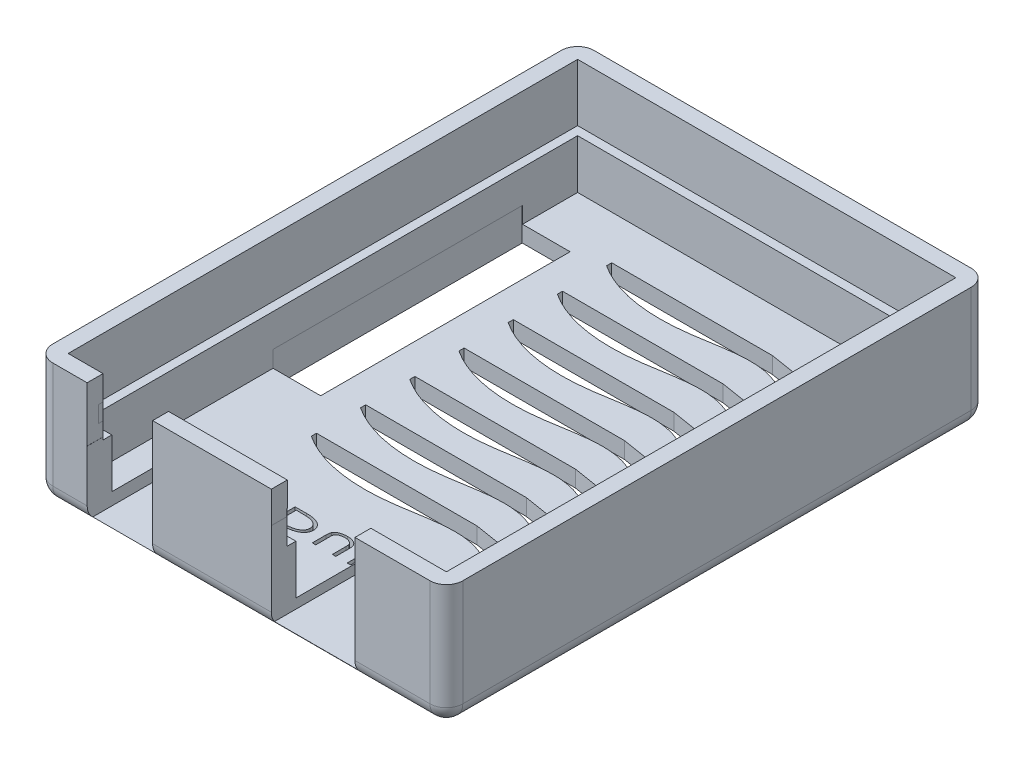
from build123d import *

# Parameters (mm, degrees)
SKETCH1_W           = 63.5
SKETCH1_H           = 83.82
BOSS_EXTRUDE1_DEPTH = 12.7
SKETCH3_W           = 55.88
SKETCH3_H           = 76.2
CUT_EXTRUDE1_DEPTH  = 15.24
SKETCH4_W           = 63.5
SKETCH4_H           = 83.82
SKETCH4_W_2         = 58.5724
SKETCH4_H_2         = 78.8924
BOSS_EXTRUDE2_DEPTH = 3.81
SKETCH5_W           = 63.5
SKETCH5_H           = 83.82
BOSS_EXTRUDE3_DEPTH = 2.54
SKETCH8_W           = 12.955380848
SKETCH8_H           = 11.85067447
CUT_EXTRUDE2_DEPTH  = 10.16
SKETCH9_W           = 10.132782245
SKETCH9_H           = 12.7
CUT_EXTRUDE3_DEPTH  = 15.24
SKETCH12_W          = 12.942292939
SKETCH12_H          = 9.189629165
SKETCH12_W_2        = 10.145904329
SKETCH12_H_2        = 9.559094667
CUT_EXTRUDE6_DEPTH  = 2.54
SKETCH13_W          = 12.972569565
SKETCH13_H          = 1.805943313
CUT_EXTRUDE7_DEPTH  = 2.54
SKETCH15_W          = 10.147954147
SKETCH15_H          = 2.455098586
CUT_EXTRUDE8_DEPTH  = 2.54
SKETCH16_W          = 58.5724
SKETCH16_H          = 78.8924
CUT_EXTRUDE9_DEPTH  = 5.08
SKETCH17_W          = 10.133611687
SKETCH17_H          = 1.27
SKETCH17_W_2        = 12.955380848
CUT_EXTRUDE10_DEPTH = 12.7
CUT_EXTRUDE11_START = -1.501766
SKETCH18_W          = 12.993067215
SKETCH18_H          = 5.08
CUT_EXTRUDE11_DEPTH = 1.501766
SKETCH19_W          = 10.132782245
SKETCH19_H          = 2.54
CUT_EXTRUDE12_DEPTH = 1.27
SKETCH21_W          = 7.415059291
SKETCH21_H          = 38.632759047
SKETCH21_W_2        = 7.602045691
SKETCH21_H_2        = 47.968625751
CUT_EXTRUDE13_DEPTH = 5.08
CUT_EXTRUDE14_DEPTH = 5.08
FILLET1_R           = 2.54
SKETCH23_W          = 0.538461539
SKETCH23_H          = 3.5
CUT_EXTRUDE17_DEPTH = 5.08
FILLET2_R           = 2.54


with BuildPart() as part:
    # Sketch1 → Boss-Extrude1 (new body)
    with BuildSketch(Plane(origin=(0, 0, 0), x_dir=(1, 0, 0), z_dir=(0, 1, 0))):
        Rectangle(SKETCH1_W, SKETCH1_H)
    extrude(amount=BOSS_EXTRUDE1_DEPTH)

    # Sketch3 → Cut-Extrude1 (cut)
    with BuildSketch(Plane(origin=(0, 12.7, 0), x_dir=(1, 0, 0), z_dir=(0, 1, 0))):
        Rectangle(SKETCH3_W, SKETCH3_H)
    extrude(amount=-CUT_EXTRUDE1_DEPTH, mode=Mode.SUBTRACT)

    # Sketch4 → Boss-Extrude2 (add)
    with BuildSketch(Plane(origin=(0, 12.7, 0), x_dir=(1, 0, 0), z_dir=(0, 1, 0))):
        Rectangle(SKETCH4_W, SKETCH4_H)
        Rectangle(SKETCH4_W_2, SKETCH4_H_2, mode=Mode.SUBTRACT)
    extrude(amount=BOSS_EXTRUDE2_DEPTH)

    # Sketch5 → Boss-Extrude3 (add)
    with BuildSketch(Plane(origin=(0, 0, 0), x_dir=(-1, 0, 0), z_dir=(0, -1, 0))):
        Rectangle(SKETCH5_W, SKETCH5_H)
    extrude(amount=BOSS_EXTRUDE3_DEPTH)

    # Sketch8 → Cut-Extrude2 (cut)
    with BuildSketch(Plane.XY.offset(41.91)):
        with Locations((11.109652355, 5.693570988)):
            Rectangle(SKETCH8_W, SKETCH8_H)
    extrude(amount=-CUT_EXTRUDE2_DEPTH, mode=Mode.SUBTRACT)

    # Sketch9 → Cut-Extrude3 (cut)
    with BuildSketch(Plane.XY.offset(41.91)):
        with Locations((-18.810194058, 5.71019893)):
            Rectangle(SKETCH9_W, SKETCH9_H)
    extrude(amount=-CUT_EXTRUDE3_DEPTH, mode=Mode.SUBTRACT)

    # Sketch12 → Cut-Extrude6 (cut)
    with BuildSketch(Plane.XY.offset(41.91)):
        with Locations((11.11619631, 13.960920215)):
            Rectangle(SKETCH12_W, SKETCH12_H)
        with Locations((-18.816755099, 12.801375619)):
            Rectangle(SKETCH12_W_2, SKETCH12_H_2)
    extrude(amount=-CUT_EXTRUDE6_DEPTH, mode=Mode.SUBTRACT)

    # Sketch13 → Cut-Extrude7 (cut)
    with BuildSketch(Plane(origin=(0, 12.7, 0), x_dir=(1, 0, 0), z_dir=(0, 1, 0))):
        with Locations((11.122724292, -38.668967122)):
            Rectangle(SKETCH13_W, SKETCH13_H)
    extrude(amount=-CUT_EXTRUDE7_DEPTH, mode=Mode.SUBTRACT)

    # Sketch15 → Cut-Extrude8 (cut)
    with BuildSketch(Plane(origin=(0, 12.7, 0), x_dir=(1, 0, 0), z_dir=(0, 1, 0))):
        with Locations((-18.817780009, -38.931642821)):
            Rectangle(SKETCH15_W, SKETCH15_H)
    extrude(amount=-CUT_EXTRUDE8_DEPTH, mode=Mode.SUBTRACT)

    # Sketch16 → Cut-Extrude9 (cut)
    with BuildSketch(Plane(origin=(0, 12.7, 0), x_dir=(1, 0, 0), z_dir=(0, 1, 0))):
        Rectangle(SKETCH16_W, SKETCH16_H)
    extrude(amount=-CUT_EXTRUDE9_DEPTH, mode=Mode.SUBTRACT)

    # Sketch17 → Cut-Extrude10 (cut)
    with BuildSketch(Plane.XY.offset(41.91)):
        with Locations((-18.809779337, -1.27480107)):
            Rectangle(SKETCH17_W, SKETCH17_H)
        with Locations((11.109652355, -0.866766247)):
            Rectangle(SKETCH17_W_2, SKETCH17_H)
    extrude(amount=-CUT_EXTRUDE10_DEPTH, mode=Mode.SUBTRACT)

    # Sketch18 → Cut-Extrude11 (cut)
    with BuildSketch(Plane(origin=(0, 0, 0), x_dir=(1, 0, 0), z_dir=(0, 1, 0)).offset(CUT_EXTRUDE11_START)):
        with Locations((11.128495539, -29.21)):
            Rectangle(SKETCH18_W, SKETCH18_H)
    extrude(amount=CUT_EXTRUDE11_DEPTH, mode=Mode.SUBTRACT)

    # Sketch19 → Cut-Extrude12 (cut)
    with BuildSketch(Plane(origin=(0, -0.63980107, 0), x_dir=(1, 0, 0), z_dir=(0, 1, 0))):
        with Locations((-18.810194058, -27.94)):
            Rectangle(SKETCH19_W, SKETCH19_H)
    extrude(amount=-CUT_EXTRUDE12_DEPTH, mode=Mode.SUBTRACT)

    # Sketch21 → Cut-Extrude13 (cut)
    with BuildSketch(Plane(origin=(0, -2.54, 0), x_dir=(-1, 0, 0), z_dir=(0, -1, 0))):
        with Locations((24.279917783, 10.255762407)):
            Rectangle(SKETCH21_W, SKETCH21_H)
        with Locations((-24.085027372, 5.66722687)):
            Rectangle(SKETCH21_W_2, SKETCH21_H_2)
    extrude(amount=-CUT_EXTRUDE13_DEPTH, mode=Mode.SUBTRACT)

    # Sketch22 → Cut-Extrude14 (cut)
    with BuildSketch(Plane.XZ.offset(2.54)):
        with BuildLine():
            Line((13.960151208, 18.364141509), (13.960151208, 15.206601395))
            Line((13.960151208, 15.206601395), (8.996481101, 14.406807536))
            Line((8.996481101, 14.406807536), (-15.870995504, 14.406807536))
            Line((-15.870995504, 14.406807536), (-15.870995504, 15.206601395))
            add(Edge.make_bspline(
                [(13.960151208, 18.364141509), (9.206801531, 15.593589968), (-0.809040501, 19.194103188), (-11.638896479, 17.993086123), (-15.870995504, 15.206601395)],
                knots=[0, 0, 0, 0, 0.502363347, 1, 1, 1, 1], degree=3))
        make_face()
        with BuildLine():
            Line((13.960151208, 10.744141509), (13.960151208, 7.586601395))
            Line((13.960151208, 7.586601395), (8.996481101, 6.786807536))
            Line((8.996481101, 6.786807536), (-15.870995504, 6.786807536))
            Line((-15.870995504, 6.786807536), (-15.870995504, 7.586601395))
            add(Edge.make_bspline(
                [(13.960151208, 10.744141509), (9.206801531, 7.973589968), (-0.809040501, 11.574103188), (-11.638896479, 10.373086123), (-15.870995504, 7.586601395)],
                knots=[0, 0, 0, 0, 0.502363347, 1, 1, 1, 1], degree=3))
        make_face()
        with BuildLine():
            Line((13.960151208, 3.124141509), (13.960151208, -0.033398605))
            Line((13.960151208, -0.033398605), (8.996481101, -0.833192464))
            Line((8.996481101, -0.833192464), (-15.870995504, -0.833192464))
            Line((-15.870995504, -0.833192464), (-15.870995504, -0.033398605))
            add(Edge.make_bspline(
                [(13.960151208, 3.124141509), (9.206801531, 0.353589968), (-0.809040501, 3.954103188), (-11.638896479, 2.753086123), (-15.870995504, -0.033398605)],
                knots=[0, 0, 0, 0, 0.502363347, 1, 1, 1, 1], degree=3))
        make_face()
        with BuildLine():
            Line((13.960151208, -4.495858491), (13.960151208, -7.653398605))
            Line((13.960151208, -7.653398605), (8.996481101, -8.453192464))
            Line((8.996481101, -8.453192464), (-15.870995504, -8.453192464))
            Line((-15.870995504, -8.453192464), (-15.870995504, -7.653398605))
            add(Edge.make_bspline(
                [(13.960151208, -4.495858491), (9.206801531, -7.266410032), (-0.809040501, -3.665896812), (-11.638896479, -4.866913877), (-15.870995504, -7.653398605)],
                knots=[0, 0, 0, 0, 0.502363347, 1, 1, 1, 1], degree=3))
        make_face()
        with BuildLine():
            Line((13.960151208, -12.115858491), (13.960151208, -15.273398605))
            Line((13.960151208, -15.273398605), (8.996481101, -16.073192464))
            Line((8.996481101, -16.073192464), (-15.870995504, -16.073192464))
            Line((-15.870995504, -16.073192464), (-15.870995504, -15.273398605))
            add(Edge.make_bspline(
                [(13.960151208, -12.115858491), (9.206801531, -14.886410032), (-0.809040501, -11.285896812), (-11.638896479, -12.486913877), (-15.870995504, -15.273398605)],
                knots=[0, 0, 0, 0, 0.502363347, 1, 1, 1, 1], degree=3))
        make_face()
        with BuildLine():
            Line((13.960151208, -19.735858491), (13.960151208, -22.893398605))
            Line((13.960151208, -22.893398605), (8.996481101, -23.693192464))
            Line((8.996481101, -23.693192464), (-15.870995504, -23.693192464))
            Line((-15.870995504, -23.693192464), (-15.870995504, -22.893398605))
            add(Edge.make_bspline(
                [(13.960151208, -19.735858491), (9.206801531, -22.506410032), (-0.809040501, -18.905896812), (-11.638896479, -20.106913877), (-15.870995504, -22.893398605)],
                knots=[0, 0, 0, 0, 0.502363347, 1, 1, 1, 1], degree=3))
        make_face()
        with BuildLine():
            Line((13.960151208, -27.355858491), (13.960151208, -30.513398605))
            Line((13.960151208, -30.513398605), (8.996481101, -31.313192464))
            Line((8.996481101, -31.313192464), (-15.870995504, -31.313192464))
            Line((-15.870995504, -31.313192464), (-15.870995504, -30.513398605))
            add(Edge.make_bspline(
                [(13.960151208, -27.355858491), (9.206801531, -30.126410032), (-0.809040501, -26.525896812), (-11.638896479, -27.726913877), (-15.870995504, -30.513398605)],
                knots=[0, 0, 0, 0, 0.502363347, 1, 1, 1, 1], degree=3))
        make_face()
    extrude(amount=-CUT_EXTRUDE14_DEPTH, mode=Mode.SUBTRACT)

    # Fillet1
    # the kernel refuses this fillet: 2.54 mm, written as the material it takes off along each edge
    with BuildSketch(Plane(origin=(-38.1, -2.54, -41.91), x_dir=(0, 1, 0), z_dir=(1, 0, 0))) as fillet1_piece_1:
        with BuildLine():
            CenterArc((FILLET1_R, FILLET1_R), FILLET1_R, 180, 90)
            Line((0, FILLET1_R), (0, 0))
            Line((0, 0), (FILLET1_R, 0))
        make_face()
    extrude(amount=76.2, mode=Mode.SUBTRACT)
    with BuildSketch(Plane(origin=(-31.75, -2.54, 48.26), x_dir=(1, 0, 0), z_dir=(0, 0, -1))) as fillet1_piece_2:
        with BuildLine():
            CenterArc((FILLET1_R, -FILLET1_R), FILLET1_R, 90, 90)
            Line((0, -FILLET1_R), (0, 0))
            Line((0, 0), (FILLET1_R, 0))
        make_face()
    extrude(amount=96.52, mode=Mode.SUBTRACT)
    with BuildSketch(Plane(origin=(38.1, -2.54, 41.91), x_dir=(0, 0, -1), z_dir=(-1, 0, 0))) as fillet1_piece_3:
        with BuildLine():
            CenterArc((FILLET1_R, -FILLET1_R), FILLET1_R, 90, 90)
            Line((0, -FILLET1_R), (0, 0))
            Line((0, 0), (FILLET1_R, 0))
        make_face()
    extrude(amount=76.2, mode=Mode.SUBTRACT)
    with BuildSketch(Plane(origin=(31.75, -2.54, -48.26), x_dir=(0, 1, 0), z_dir=(0, 0, 1))) as fillet1_piece_4:
        with BuildLine():
            CenterArc((FILLET1_R, FILLET1_R), FILLET1_R, 180, 90)
            Line((0, FILLET1_R), (0, 0))
            Line((0, 0), (FILLET1_R, 0))
        make_face()
    extrude(amount=96.52, mode=Mode.SUBTRACT)

    # Sketch23 → Cut-Extrude17 (cut)
    # profile 1 of 7: a face of its own
    with BuildSketch(Plane.XZ.offset(2.54)):
        Polygon((-16.712112289, 29.431104987), (-14.154419981, 25.931104987), (-14.74756902, 25.931104987), (-15.567180398, 27.052899859), (-17.974832642, 27.052899859), (-18.809167577, 25.931104987), (-19.404419981, 25.931104987), (-16.801855879, 29.431104987), align=None)
        Polygon((-16.761190815, 28.685812519), (-17.708406359, 27.411874218), (-15.829399949, 27.411874218), align=None, mode=Mode.SUBTRACT)
    # profile 2 of 7: a face of its own
    with BuildSketch(Plane.XZ.offset(2.54)):
        with BuildLine():
            Line((-12.790317417, 29.431104987), (-11.675533763, 29.431104987))
            add(Edge.make_bspline(
                [(-11.675533763, 29.431104987), (-11.600981338, 29.430951106), (-11.4581833, 29.430656362), (-11.253434401, 29.42897401), (-11.067420098, 29.424211029), (-10.900264487, 29.420126725), (-10.751887259, 29.412583378), (-10.62209828, 29.405483023), (-10.510999879, 29.396078054), (-10.443406349, 29.387369989), (-10.412813411, 29.383428705)],
                knots=[0, 0, 0, 0, 1.415159153, 2.710601944, 3.886499888, 4.947209645, 5.884301401, 6.706450434, 7.414537418, 8, 8, 8, 8], degree=3))
            add(Edge.make_bspline(
                [(-10.412813411, 29.383428705), (-10.372058355, 29.377141148), (-10.292235397, 29.364826323), (-10.176266387, 29.338400266), (-10.066009817, 29.307660242), (-9.961328002, 29.272269421), (-9.862891286, 29.230599259), (-9.770128333, 29.184292701), (-9.682774842, 29.133381175), (-9.602722685, 29.076608294), (-9.529292871, 29.016716978), (-9.465416473, 28.952458518), (-9.411591935, 28.884335889), (-9.366661213, 28.813519673), (-9.333198893, 28.738404319), (-9.308093595, 28.66048149), (-9.293107084, 28.57888177), (-9.291253323, 28.52321288), (-9.290317417, 28.495107391)],
                knots=[0, 0, 0, 0, 1.268032383, 2.483571505, 3.65563143, 4.787705483, 5.8797964, 6.940662136, 7.975015907, 8.986154035, 9.956240188, 10.886435316, 11.766594594, 12.622284502, 13.458736103, 14.288520174, 15.135927109, 16, 16, 16, 16], degree=3))
            add(Edge.make_bspline(
                [(-9.290317417, 28.495107391), (-9.291055535, 28.471474734), (-9.292516233, 28.424706909), (-9.302233144, 28.355475994), (-9.320000967, 28.288854791), (-9.344312341, 28.224469116), (-9.373960136, 28.161604815), (-9.412867087, 28.102064915), (-9.456646731, 28.043527227), (-9.508239324, 27.988264265), (-9.565884736, 27.935781336), (-9.629009532, 27.88591121), (-9.698099186, 27.839424109), (-9.77323286, 27.79683148), (-9.85437561, 27.757549358), (-9.94116135, 27.721139536), (-10.033899158, 27.688318022), (-10.132806098, 27.658552139), (-10.239602825, 27.632809677), (-10.355257434, 27.60934166), (-10.480819309, 27.591194226), (-10.615661638, 27.574782357), (-10.760188959, 27.562409651), (-10.91449117, 27.553424066), (-11.078370155, 27.547771859), (-11.190820272, 27.546924582), (-11.24855059, 27.546489602)],
                knots=[0, 0, 0, 0, 0.707777751, 1.400656194, 2.088211549, 2.768136518, 3.45995362, 4.164783657, 4.894105013, 5.646958891, 6.424744507, 7.227084093, 8.054048316, 8.916106943, 9.811366436, 10.752482584, 11.733185226, 12.756207988, 13.84434188, 15.022068865, 16.289085255, 17.642525751, 19.089840076, 20.632334465, 22.271087571, 24, 24, 24, 24], degree=3))
            Line((-11.24855059, 27.546489602), (-9.245445622, 25.931104987))
            Line((-9.245445622, 25.931104987), (-9.929039372, 25.931104987))
            Line((-9.929039372, 25.931104987), (-11.93214434, 27.546489602))
            Line((-11.93214434, 27.546489602), (-12.251855879, 27.546489602))
            Line((-12.251855879, 27.546489602), (-12.251855879, 25.931104987))
            Line((-12.251855879, 25.931104987), (-12.790317417, 25.931104987))
            Line((-12.790317417, 25.931104987), (-12.790317417, 29.431104987))
        make_face()
        with BuildLine():
            Line((-12.251855879, 29.072130628), (-12.251855879, 27.905463961))
            Line((-12.251855879, 27.905463961), (-11.263274148, 27.900556109))
            add(Edge.make_bspline(
                [(-11.263274148, 27.900556109), (-11.216996458, 27.900539913), (-11.127464276, 27.900508579), (-10.997757926, 27.904530304), (-10.877355723, 27.909011437), (-10.766308145, 27.916011097), (-10.664594254, 27.924996116), (-10.572198914, 27.936013117), (-10.489133896, 27.949202677), (-10.392874119, 27.969186715), (-10.28541794, 28.000412452), (-10.168921086, 28.046599892), (-10.06848009, 28.10472152), (-9.982804513, 28.170686841), (-9.915297375, 28.245070549), (-9.864971643, 28.324031316), (-9.83466386, 28.408623571), (-9.830734662, 28.466834695), (-9.828778956, 28.495808512)],
                knots=[0, 0, 0, 0, 1.303746908, 2.522323553, 3.655794447, 4.698226492, 5.656807957, 6.532323161, 7.31930133, 8.025686149, 9.300972384, 10.467469391, 11.547166185, 12.56010915, 13.501761196, 14.362342528, 15.184877645, 16, 16, 16, 16], degree=3))
            add(Edge.make_bspline(
                [(-9.828778956, 28.495808512), (-9.830654432, 28.524123154), (-9.834430465, 28.581131094), (-9.86619742, 28.663352547), (-9.915668831, 28.741521533), (-9.985515389, 28.812452254), (-10.068942111, 28.878330883), (-10.166977143, 28.93344574), (-10.276533855, 28.979273746), (-10.377497742, 29.008104625), (-10.467918602, 29.026253666), (-10.547186856, 29.038841783), (-10.637018949, 29.049169739), (-10.73736071, 29.057231941), (-10.847905409, 29.064376463), (-10.969001132, 29.069110072), (-11.100599938, 29.071924907), (-11.19199188, 29.072060327), (-11.239436007, 29.072130628)],
                knots=[0, 0, 0, 0, 0.811392974, 1.633636845, 2.500034114, 3.454872133, 4.47862469, 5.546562085, 6.675379086, 7.884810079, 8.556549997, 9.32503235, 10.190570188, 11.154341789, 12.217601863, 13.373719765, 14.636624069, 16, 16, 16, 16], degree=3))
            Line((-11.239436007, 29.072130628), (-12.251855879, 29.072130628))
        make_face(mode=Mode.SUBTRACT)
    # profile 3 of 7: a face of its own
    with BuildSketch(Plane.XZ.offset(2.54)):
        with BuildLine():
            Line((-7.656984084, 25.931104987), (-7.656984084, 29.431104987))
            Line((-7.656984084, 29.431104987), (-6.530281359, 29.431104987))
            add(Edge.make_bspline(
                [(-6.530281359, 29.431104987), (-6.480267634, 29.430927985), (-6.382108113, 29.430580591), (-6.237442032, 29.429102794), (-6.098142089, 29.427199078), (-5.963979087, 29.42380777), (-5.835238087, 29.418431315), (-5.711564614, 29.414007219), (-5.59306244, 29.407658664), (-5.479727294, 29.399859189), (-5.37175219, 29.39143303), (-5.269094777, 29.382590966), (-5.171683548, 29.371783768), (-5.079273848, 29.360981423), (-4.992148925, 29.348105054), (-4.910330173, 29.334871157), (-4.833541009, 29.321149044), (-4.78445465, 29.310208662), (-4.760649949, 29.304903064)],
                knots=[0, 0, 0, 0, 1.350811625, 2.651172703, 3.907430285, 5.113461085, 6.275734084, 7.387548164, 8.455810569, 9.480731027, 10.45574647, 11.380964214, 12.263444926, 13.102745277, 13.893653518, 14.641847889, 15.341356621, 16, 16, 16, 16], degree=3))
            add(Edge.make_bspline(
                [(-4.760649949, 29.304903064), (-4.69641601, 29.289523895), (-4.570490583, 29.259374282), (-4.388773473, 29.202410846), (-4.217997205, 29.136992352), (-4.057255621, 29.064504632), (-3.908221751, 28.982127265), (-3.768796579, 28.893161324), (-3.641229315, 28.794787976), (-3.524542566, 28.688935568), (-3.420204819, 28.576463315), (-3.328947289, 28.458199402), (-3.252158266, 28.334357474), (-3.18943547, 28.205076021), (-3.139618183, 28.07070512), (-3.10596229, 27.930369378), (-3.083890607, 27.785335926), (-3.081347721, 27.686796045), (-3.080061007, 27.636934314)],
                knots=[0, 0, 0, 0, 1.232647653, 2.416505715, 3.551581262, 4.644824175, 5.704995897, 6.727519334, 7.729227062, 8.708191178, 9.665184006, 10.589223822, 11.492348546, 12.380096058, 13.267532665, 14.161603306, 15.069760985, 16, 16, 16, 16], degree=3))
            add(Edge.make_bspline(
                [(-3.080061007, 27.636934314), (-3.081193791, 27.593654285), (-3.0834306, 27.508193049), (-3.099558812, 27.381998003), (-3.12808141, 27.260126005), (-3.166634393, 27.142063494), (-3.215844774, 27.027462619), (-3.277337228, 26.917534032), (-3.348976398, 26.810975243), (-3.432080295, 26.710056187), (-3.522627785, 26.61340053), (-3.621596289, 26.523584866), (-3.726132467, 26.439443584), (-3.838087454, 26.362813865), (-3.955712707, 26.291628862), (-4.080904524, 26.228145619), (-4.212241734, 26.170620839), (-4.351084708, 26.118733603), (-4.500430415, 26.07360436), (-4.662738189, 26.03533789), (-4.839038346, 26.003502174), (-5.0294437, 25.97704608), (-5.234057052, 25.956039904), (-5.452964891, 25.941889197), (-5.685812557, 25.932381016), (-5.845742587, 25.931538444), (-5.928017738, 25.931104987)],
                knots=[0, 0, 0, 0, 0.839306076, 1.657303312, 2.462122006, 3.263359048, 4.063248836, 4.876813816, 5.702746589, 6.550091711, 7.409414165, 8.269214631, 9.139889763, 10.009915775, 10.898400356, 11.804514408, 12.730010374, 13.67800782, 14.677402505, 15.753690759, 16.910309298, 18.150648225, 19.481120666, 20.898477093, 22.404438092, 24, 24, 24, 24], degree=3))
            Line((-5.928017738, 25.931104987), (-7.656984084, 25.931104987))
        make_face()
        with BuildLine():
            Line((-7.118522545, 26.290079346), (-6.491719661, 26.290079346))
            add(Edge.make_bspline(
                [(-6.491719661, 26.290079346), (-6.445678424, 26.289935725), (-6.355463172, 26.289654307), (-6.222958813, 26.291670923), (-6.095802707, 26.292378651), (-5.974062533, 26.29585808), (-5.85763977, 26.297936376), (-5.746667007, 26.302843338), (-5.640973888, 26.3063057), (-5.540769096, 26.31258369), (-5.446038431, 26.31749478), (-5.356829797, 26.325070046), (-5.272887333, 26.331796995), (-5.194052005, 26.339223565), (-5.120774081, 26.348814568), (-5.052595097, 26.357293011), (-4.990301173, 26.36815373), (-4.950646291, 26.375578732), (-4.931723667, 26.379121814)],
                knots=[0, 0, 0, 0, 1.412529061, 2.76777241, 4.065657525, 5.313601647, 6.504200063, 7.637907955, 8.721462284, 9.748403905, 10.718078786, 11.631512519, 12.494918726, 13.301844826, 14.060464003, 14.762191641, 15.409339276, 16, 16, 16, 16], degree=3))
            add(Edge.make_bspline(
                [(-4.931723667, 26.379121814), (-4.881825123, 26.390315582), (-4.784214959, 26.412212526), (-4.642800776, 26.452677883), (-4.510285529, 26.50065524), (-4.385334545, 26.553703265), (-4.268886198, 26.614007451), (-4.160728833, 26.680735795), (-4.060305079, 26.75320378), (-3.968621189, 26.832064312), (-3.886601257, 26.916890439), (-3.814592434, 27.006024423), (-3.753621994, 27.099856401), (-3.704405398, 27.198777872), (-3.665570008, 27.302096186), (-3.638267011, 27.410021467), (-3.621778614, 27.522375473), (-3.619620092, 27.598783921), (-3.618522545, 27.637635436)],
                knots=[0, 0, 0, 0, 1.238897773, 2.423497863, 3.560871493, 4.651619713, 5.71024999, 6.734849785, 7.72817901, 8.707808056, 9.660892941, 10.583255092, 11.480095872, 12.366417479, 13.2551596, 14.1492253, 15.058933894, 16, 16, 16, 16], degree=3))
            add(Edge.make_bspline(
                [(-3.618522545, 27.637635436), (-3.619432483, 27.678610467), (-3.621225437, 27.759348288), (-3.640449435, 27.877687675), (-3.669702234, 27.991512169), (-3.711266952, 28.101019343), (-3.765700003, 28.205555124), (-3.831435773, 28.305870944), (-3.908893242, 28.40151628), (-3.998262686, 28.491692897), (-4.097756187, 28.576628671), (-4.207435385, 28.654178081), (-4.326067658, 28.725303131), (-4.45375369, 28.790116021), (-4.591781398, 28.846248212), (-4.738322682, 28.897087521), (-4.894478976, 28.939653907), (-5.002178837, 28.962365588), (-5.057224468, 28.973973577)],
                knots=[0, 0, 0, 0, 0.918134727, 1.809106545, 2.68114836, 3.550366467, 4.429388806, 5.319018531, 6.235761044, 7.184514272, 8.162282374, 9.165727217, 10.193085636, 11.261892079, 12.37339418, 13.531942088, 14.738570272, 16, 16, 16, 16], degree=3))
            add(Edge.make_bspline(
                [(-5.057224468, 28.973973577), (-5.102967006, 28.982107409), (-5.200890711, 28.999519976), (-5.359171226, 29.018130908), (-5.538005662, 29.034882598), (-5.737643151, 29.048812698), (-5.95786494, 29.058923265), (-6.198608735, 29.066499294), (-6.459913658, 29.071597743), (-6.641056026, 29.071948632), (-6.735008924, 29.072130628)],
                knots=[0, 0, 0, 0, 0.662548962, 1.418357028, 2.272139382, 3.224504634, 4.272396736, 5.416352635, 6.659942689, 8, 8, 8, 8], degree=3))
            Line((-6.735008924, 29.072130628), (-7.118522545, 29.072130628))
            Line((-7.118522545, 29.072130628), (-7.118522545, 26.290079346))
        make_face(mode=Mode.SUBTRACT)
    # profile 4 of 7: a face of its own
    with BuildSketch(Plane.XZ.offset(2.54)):
        with BuildLine():
            Line((-1.491599468, 29.431104987), (-0.95313793, 29.431104987))
            Line((-0.95313793, 29.431104987), (-0.95313793, 27.334049698))
            add(Edge.make_bspline(
                [(-0.95313793, 27.334049698), (-0.952859692, 27.304369967), (-0.952331695, 27.248048389), (-0.952264906, 27.16786319), (-0.949533303, 27.096608848), (-0.948191715, 27.033912816), (-0.944125854, 26.980211374), (-0.941286797, 26.934988188), (-0.936354854, 26.898765121), (-0.932402539, 26.87760786), (-0.930702033, 26.868504827)],
                knots=[0, 0, 0, 0, 1.526598744, 2.896941715, 4.123521072, 5.193916661, 6.121412846, 6.893042705, 7.523725266, 8, 8, 8, 8], degree=3))
            add(Edge.make_bspline(
                [(-0.930702033, 26.868504827), (-0.922656996, 26.835440392), (-0.906759489, 26.77010295), (-0.864496148, 26.678978614), (-0.808803441, 26.596477551), (-0.752051003, 26.534715587), (-0.69889573, 26.489897107), (-0.652949709, 26.458035345), (-0.602780603, 26.426232036), (-0.546974738, 26.397053578), (-0.48663454, 26.368915491), (-0.421141614, 26.342601164), (-0.35107479, 26.316173399), (-0.25047455, 26.285163634), (-0.121203048, 26.251167966), (0.036197154, 26.221681136), (0.19416548, 26.203457204), (0.299719211, 26.201374328), (0.352350852, 26.200335756)],
                knots=[0, 0, 0, 0, 1.045801643, 2.06657107, 3.072470035, 4.101122749, 4.637358689, 5.210380243, 5.821363902, 6.465196185, 7.147718422, 7.870658361, 8.637937189, 9.452709186, 11.110809168, 12.750806171, 14.379873434, 16, 16, 16, 16], degree=3))
            add(Edge.make_bspline(
                [(0.352350852, 26.200335756), (0.397718005, 26.201388047), (0.487476939, 26.203470006), (0.62089321, 26.216801225), (0.751012205, 26.240280352), (0.877798417, 26.27120814), (0.997437094, 26.311544576), (1.108779309, 26.358291467), (1.209104056, 26.413117629), (1.299649916, 26.474161197), (1.379826013, 26.542286409), (1.447697916, 26.618286918), (1.505515705, 26.700630362), (1.534089342, 26.760539991), (1.548464634, 26.790680307)],
                knots=[0, 0, 0, 0, 1.160128566, 2.295314919, 3.424238933, 4.538851941, 5.629283284, 6.649404383, 7.622857498, 8.547772487, 9.437758232, 10.305289315, 11.147397217, 12, 12, 12, 12], degree=3))
            add(Edge.make_bspline(
                [(1.548464634, 26.790680307), (1.553191897, 26.802977894), (1.563621129, 26.830108683), (1.573893341, 26.876899932), (1.583817511, 26.9318126), (1.591108052, 26.9955401), (1.597610969, 27.067754594), (1.601318221, 27.148925665), (1.604425154, 27.238673099), (1.604510043, 27.301327183), (1.604554378, 27.334049698)],
                knots=[0, 0, 0, 0, 0.575451023, 1.269553164, 2.089565696, 3.016269742, 4.073008382, 5.260189284, 6.569071778, 8, 8, 8, 8], degree=3))
            Line((1.604554378, 27.334049698), (1.604554378, 29.431104987))
            Line((1.604554378, 29.431104987), (2.143015916, 29.431104987))
            Line((2.143015916, 29.431104987), (2.143015916, 27.317222775))
            add(Edge.make_bspline(
                [(2.143015916, 27.317222775), (2.142700242, 27.279115946), (2.142083813, 27.204703373), (2.134707969, 27.095705645), (2.12373117, 26.992288153), (2.108584784, 26.894352539), (2.088085018, 26.802424612), (2.063762797, 26.715624944), (2.034329559, 26.634616201), (2.000710034, 26.558108888), (1.959250565, 26.486278348), (1.909817615, 26.417171017), (1.851444578, 26.350376845), (1.783210492, 26.286632864), (1.707197224, 26.223952031), (1.620592425, 26.165423077), (1.5262681, 26.107958696), (1.423530947, 26.053286612), (1.313404035, 26.003998677), (1.197093888, 25.960252494), (1.075111631, 25.923154085), (0.947238355, 25.893023302), (0.813720415, 25.870196193), (0.674759789, 25.853254233), (0.530108955, 25.84349155), (0.431825724, 25.842079933), (0.381797967, 25.841361397)],
                knots=[0, 0, 0, 0, 1.043268778, 2.037228356, 2.989848892, 3.890429281, 4.749038289, 5.56740331, 6.356885593, 7.107356366, 7.852680117, 8.623368756, 9.430649771, 10.277130075, 11.177642252, 12.125522282, 13.136313904, 14.201241459, 15.309731709, 16.437704696, 17.601698401, 18.798443081, 20.032520234, 21.308863382, 22.630167886, 24, 24, 24, 24], degree=3))
            add(Edge.make_bspline(
                [(0.381797967, 25.841361397), (0.327334861, 25.842148237), (0.220436341, 25.843692624), (0.062933443, 25.852476662), (-0.088326815, 25.869011802), (-0.234043006, 25.890100653), (-0.373339962, 25.919290705), (-0.507258731, 25.953125143), (-0.634623062, 25.994818427), (-0.755863477, 26.041334058), (-0.868966256, 26.093641876), (-0.973055351, 26.150404647), (-1.067509555, 26.211021961), (-1.151158511, 26.277150867), (-1.227194759, 26.345162731), (-1.291454593, 26.419449247), (-1.347454626, 26.496648322), (-1.376328609, 26.552141453), (-1.39063793, 26.579642647)],
                knots=[0, 0, 0, 0, 1.299134642, 2.549901722, 3.760779333, 4.927548371, 6.060153788, 7.153944609, 8.22046331, 9.254631285, 10.249767399, 11.19025671, 12.080853539, 12.92275432, 13.731580621, 14.509783883, 15.261481167, 16, 16, 16, 16], degree=3))
            add(Edge.make_bspline(
                [(-1.39063793, 26.579642647), (-1.399015415, 26.598176195), (-1.416965685, 26.637887655), (-1.436246345, 26.705256069), (-1.45388981, 26.782200889), (-1.467383479, 26.869648102), (-1.478702148, 26.966916134), (-1.485909032, 27.074549732), (-1.491104889, 27.192371707), (-1.491430021, 27.274447607), (-1.491599468, 27.317222775)],
                knots=[0, 0, 0, 0, 0.65043723, 1.393678768, 2.237767908, 3.177616437, 4.224582218, 5.372393214, 6.630580707, 8, 8, 8, 8], degree=3))
            Line((-1.491599468, 27.317222775), (-1.491599468, 29.431104987))
        make_face()
    # profile 5 of 7: a face of its own
    with BuildSketch(Plane.XZ.offset(2.54)):
        with Locations((4.180195403, 27.681104987)):
            Rectangle(SKETCH23_W, SKETCH23_H)
    # profile 6 of 7: a face of its own
    with BuildSketch(Plane.XZ.offset(2.54)):
        Polygon((6.217374891, 25.931104987), (6.217374891, 29.431104987), (6.330956621, 29.431104987), (10.031477455, 26.750716365), (10.031477455, 29.431104987), (10.569938993, 29.431104987), (10.569938993, 25.931104987), (10.447242679, 25.931104987), (6.755836429, 28.605183512), (6.755836429, 25.931104987), align=None)
    # profile 7 of 7: a face of its own
    with BuildSketch(Plane.XZ.offset(2.54)):
        with BuildLine():
            add(Edge.make_bspline(
                [(14.972002294, 29.520848577), (15.023423719, 29.520444011), (15.125370741, 29.519641927), (15.276653436, 29.513258148), (15.424833963, 29.502472046), (15.569905727, 29.489014176), (15.71179053, 29.469792912), (15.850401423, 29.446643369), (15.986063108, 29.420019392), (16.118403269, 29.389691343), (16.247149962, 29.353125229), (16.373202451, 29.314418811), (16.495987942, 29.270864579), (16.615448694, 29.223025492), (16.731799193, 29.171325263), (16.844902762, 29.114978826), (16.954979705, 29.054884133), (17.061018818, 28.990529485), (17.162423548, 28.923585657), (17.257683373, 28.854378411), (17.346416266, 28.783064422), (17.429319867, 28.710868545), (17.504499523, 28.635035941), (17.573902277, 28.55836833), (17.636812777, 28.479699861), (17.692045861, 28.398420401), (17.742531048, 28.316224402), (17.78396987, 28.230684807), (17.821220233, 28.144511435), (17.850366771, 28.055700766), (17.87390189, 27.965150328), (17.889619774, 27.872471176), (17.899892246, 27.778090008), (17.901286893, 27.714552183), (17.901990275, 27.68250723)],
                knots=[0, 0, 0, 0, 1.294878119, 2.567197822, 3.812122127, 5.036044495, 6.235440195, 7.416795779, 8.574458474, 9.716517882, 10.834562866, 11.943993381, 13.036641139, 14.114206823, 15.183836075, 16.241891045, 17.295418783, 18.341076075, 19.364519666, 20.35452158, 21.304895807, 22.230586046, 23.121148973, 23.992108169, 24.834029884, 25.655145282, 26.465625203, 27.260484317, 28.046403775, 28.828058806, 29.611705317, 30.400264606, 31.193182243, 32, 32, 32, 32], degree=3))
            add(Edge.make_bspline(
                [(17.901990275, 27.68250723), (17.901286347, 27.650696062), (17.899890683, 27.587624685), (17.889627105, 27.493938998), (17.873873311, 27.401973874), (17.850468229, 27.312065886), (17.820791544, 27.224051125), (17.78527721, 27.137559679), (17.741918083, 27.053345158), (17.693110765, 26.970277941), (17.636397597, 26.889749955), (17.574450259, 26.810378205), (17.504705449, 26.733966312), (17.430367998, 26.657788866), (17.347290275, 26.585365911), (17.259584944, 26.512583601), (17.163558754, 26.443678357), (17.028114591, 26.352726276), (16.848320107, 26.248023774), (16.62036963, 26.139518174), (16.381562912, 26.046378872), (16.130692485, 25.971840176), (15.868693876, 25.912423577), (15.594658155, 25.872121762), (15.309519601, 25.845899887), (15.115558458, 25.842891842), (15.016874089, 25.841361397)],
                knots=[0, 0, 0, 0, 0.607792499, 1.205058224, 1.799059034, 2.389405352, 2.97833094, 3.573002937, 4.174196332, 4.786940346, 5.41258531, 6.054982105, 6.709604411, 7.388575497, 8.08769348, 8.814507187, 9.565772467, 10.344889391, 11.932001489, 13.536057979, 15.164934345, 16.825108206, 18.532662519, 20.29423858, 22.114567073, 24, 24, 24, 24], degree=3))
            add(Edge.make_bspline(
                [(15.016874089, 25.841361397), (14.966386372, 25.841753681), (14.86653955, 25.84252948), (14.71830761, 25.849066238), (14.573095115, 25.859403756), (14.43076587, 25.874426679), (14.291045686, 25.892169104), (14.154510847, 25.915412049), (14.021116784, 25.943065905), (13.890376865, 25.973389914), (13.763166603, 26.009589105), (13.638453002, 26.048430211), (13.517385919, 26.09305915), (13.39864948, 26.140542646), (13.282686939, 26.192342572), (13.170219238, 26.249259696), (13.060401224, 26.30959729), (12.954478166, 26.37375271), (12.853145406, 26.440789472), (12.757547361, 26.509814813), (12.669594012, 26.582064849), (12.585907593, 26.653348458), (12.51128089, 26.729293117), (12.441603624, 26.805206475), (12.378703156, 26.883195534), (12.323682943, 26.963672456), (12.272983827, 27.044544655), (12.231568492, 27.128712299), (12.194292747, 27.213468205), (12.16527671, 27.300685776), (12.141602671, 27.389323887), (12.125904229, 27.479914725), (12.115624547, 27.57219524), (12.11423144, 27.634335724), (12.113528737, 27.665680307)],
                knots=[0, 0, 0, 0, 1.28497212, 2.541219695, 3.775761132, 4.989724474, 6.183510875, 7.359935714, 8.513689761, 9.650622556, 10.774927677, 11.87922803, 12.974407029, 14.05800699, 15.133675827, 16.205736712, 17.265348528, 18.322218609, 19.356636787, 20.357254685, 21.32155154, 22.253245756, 23.153358364, 24.029244677, 24.875545533, 25.700569836, 26.509570202, 27.302312036, 28.085715021, 28.864474737, 29.639248672, 30.41868962, 31.202363553, 32, 32, 32, 32], degree=3))
            add(Edge.make_bspline(
                [(12.113528737, 27.665680307), (12.114857038, 27.707335991), (12.117502829, 27.790308301), (12.135302371, 27.913722349), (12.165720474, 28.034817285), (12.208088445, 28.153450905), (12.261565446, 28.270108706), (12.328117731, 28.383789722), (12.40605474, 28.495509661), (12.496112557, 28.603835143), (12.595742242, 28.70849221), (12.705039652, 28.807696513), (12.822848919, 28.900946105), (12.949592226, 28.987867502), (13.084585474, 29.069495891), (13.228527766, 29.144900939), (13.380888579, 29.215420558), (13.541595394, 29.278238513), (13.707618621, 29.336064742), (13.878483092, 29.384653639), (14.052396733, 29.427057224), (14.229780189, 29.461199527), (14.410589434, 29.488096679), (14.594745071, 29.506445883), (14.782284125, 29.519274182), (14.908411868, 29.520320865), (14.972002294, 29.520848577)],
                knots=[0, 0, 0, 0, 0.799719897, 1.592930447, 2.388460128, 3.193149459, 4.008279729, 4.848693701, 5.71879325, 6.620784912, 7.550692945, 8.490904118, 9.452364309, 10.433136999, 11.43968337, 12.479378785, 13.55148963, 14.661358721, 15.790890545, 16.925588704, 18.070488051, 19.226813839, 20.392530054, 21.578833648, 22.779309009, 24, 24, 24, 24], degree=3))
        make_face()
        with BuildLine():
            add(Edge.make_bspline(
                [(14.996541557, 29.161874218), (14.945341347, 29.161470753), (14.843544777, 29.160668581), (14.692018243, 29.150072156), (14.542520661, 29.13497598), (14.395032602, 29.113468925), (14.249731512, 29.084141097), (14.106162098, 29.050286827), (13.964693771, 29.009290165), (13.826286489, 28.962561461), (13.692310891, 28.911551467), (13.565732033, 28.85429461), (13.446341269, 28.79333602), (13.334105798, 28.728567292), (13.229944546, 28.658622832), (13.132727691, 28.585247953), (13.043610021, 28.506548823), (12.962480106, 28.423935954), (12.889169365, 28.338680931), (12.825756846, 28.250030832), (12.772211741, 28.158732794), (12.728736679, 28.064934479), (12.693517612, 27.969259144), (12.670333398, 27.870557842), (12.654664961, 27.769712383), (12.652887186, 27.701497726), (12.651990275, 27.667082551)],
                knots=[0, 0, 0, 0, 1.20539346, 2.396570611, 3.57497992, 4.743167809, 5.904452323, 7.064379951, 8.215646148, 9.371179104, 10.503547432, 11.589791292, 12.64072232, 13.659164164, 14.639051547, 15.593322664, 16.525178768, 17.435781625, 18.318005585, 19.170125376, 19.998821888, 20.806362843, 21.601888623, 22.394726004, 23.190118532, 24, 24, 24, 24], degree=3))
            add(Edge.make_bspline(
                [(12.651990275, 27.667082551), (12.652589601, 27.64159185), (12.65377996, 27.590963206), (12.661459389, 27.515919727), (12.674994202, 27.442361007), (12.693693454, 27.370309773), (12.718626414, 27.299960086), (12.748177713, 27.230777491), (12.782934251, 27.163197635), (12.823558121, 27.097334536), (12.869069606, 27.032819721), (12.920211471, 26.969879745), (12.976925454, 26.908600609), (13.038283171, 26.848211352), (13.105987431, 26.790305937), (13.178324855, 26.733222643), (13.256329265, 26.677898699), (13.367695226, 26.605928703), (13.515012118, 26.523129686), (13.700665301, 26.436725525), (13.895124262, 26.363335365), (14.098564957, 26.304485695), (14.310548915, 26.256651694), (14.531641036, 26.224842614), (14.761241224, 26.203384558), (14.917263713, 26.201362964), (14.996541557, 26.200335756)],
                knots=[0, 0, 0, 0, 0.603559815, 1.198767137, 1.783778379, 2.372987976, 2.959254047, 3.549242645, 4.153106775, 4.756691956, 5.380018017, 6.021262176, 6.675271959, 7.356142468, 8.058376626, 8.783457974, 9.537358368, 10.321675234, 11.922269585, 13.53389282, 15.165972072, 16.838203673, 18.544557181, 20.306912047, 22.123475312, 24, 24, 24, 24], degree=3))
            add(Edge.make_bspline(
                [(14.996541557, 26.200335756), (15.050073898, 26.200810671), (15.15604986, 26.201750843), (15.313468928, 26.211193527), (15.467865488, 26.226447665), (15.619387021, 26.248358573), (15.767908457, 26.275664143), (15.91363252, 26.308273847), (16.055663643, 26.348609818), (16.194300524, 26.393789338), (16.327368557, 26.444738026), (16.454144057, 26.500041585), (16.573222392, 26.560322519), (16.684860615, 26.624591071), (16.788655354, 26.69364091), (16.884668587, 26.767470252), (16.974208854, 26.844900783), (17.054681803, 26.927832088), (17.12683632, 27.013856304), (17.190311128, 27.102211213), (17.244124277, 27.193112574), (17.287672386, 27.286614859), (17.321674158, 27.382384766), (17.345343735, 27.480622994), (17.360785959, 27.581057442), (17.362611058, 27.649030694), (17.363528737, 27.683208352)],
                knots=[0, 0, 0, 0, 1.252830065, 2.480180595, 3.689591304, 4.883226063, 6.062333592, 7.223451698, 8.376813072, 9.516748776, 10.635234708, 11.710497506, 12.752622531, 13.757458467, 14.723861308, 15.668041421, 16.59067993, 17.491975758, 18.369537821, 19.216528843, 20.035519954, 20.838200453, 21.627100732, 22.409851688, 23.20045688, 24, 24, 24, 24], degree=3))
            add(Edge.make_bspline(
                [(17.363528737, 27.683208352), (17.362610589, 27.717152476), (17.360784567, 27.784660886), (17.345349148, 27.884400368), (17.321649436, 27.981928674), (17.28781676, 28.076844818), (17.244083221, 28.169113304), (17.19029729, 28.25863148), (17.126756529, 28.34551745), (17.054720766, 28.430500883), (16.973254626, 28.511208898), (16.884610633, 28.588934859), (16.787485603, 28.661884481), (16.682251349, 28.730195949), (16.569609143, 28.795137918), (16.448871295, 28.855143144), (16.320390441, 28.911254113), (16.185035873, 28.962598142), (16.044810259, 29.009548395), (15.901332854, 29.050039524), (15.755760057, 29.084262624), (15.608329777, 29.113518468), (15.458267111, 29.13497407), (15.306199766, 29.150036377), (15.152107884, 29.160688715), (15.048676632, 29.161476919), (14.996541557, 29.161874218)],
                knots=[0, 0, 0, 0, 0.796333592, 1.58375616, 2.363401762, 3.149370814, 3.944399669, 4.756282163, 5.596774191, 6.468444473, 7.36834506, 8.285862564, 9.233771135, 10.216652546, 11.229092722, 12.283977442, 13.379567602, 14.518559496, 15.680800923, 16.84948427, 18.016376747, 19.190095884, 20.376260235, 21.572730247, 22.776521714, 24, 24, 24, 24], degree=3))
        make_face(mode=Mode.SUBTRACT)
    extrude(amount=-CUT_EXTRUDE17_DEPTH, mode=Mode.SUBTRACT)


with BuildPart() as cut_extrude17_piece_1:
    # of the separate pieces the step leaves, piece 1, a body of its own (cut_extrude17_pieces)
    add(part.part.solids().sort_by_distance((-31.75, 0, -41.91))[0])

    # Fillet2
    # the kernel refuses this fillet: 2.54 mm, written as the material it takes off along each edge
    with BuildSketch(Plane(origin=(-29.21, 0, 39.37), x_dir=(0, 0, 1), z_dir=(-1, 0, 0))) as fillet2_piece_1_section:
        Polygon((0, 0), (FILLET2_R, 0), (FILLET2_R, -FILLET2_R), (0, -FILLET2_R), align=None)
    fillet2_piece_1 = extrude(amount=FILLET2_R, mode=Mode.PRIVATE)
    fillet2_piece_1 = fillet2_piece_1 - Plane(origin=(-29.21, 0, 39.37), x_dir=(0, 0.7071067811865475, -0.7071067811865475), z_dir=(-1, 0, 0)) * Sphere(FILLET2_R, mode=Mode.PRIVATE)
    add(fillet2_piece_1, mode=Mode.SUBTRACT)
    with BuildSketch(Plane(origin=(29.21, 0, 39.37), x_dir=(0, 0, 1), z_dir=(1, 0, 0))) as fillet2_piece_2_section:
        Polygon((0, 0), (FILLET2_R, 0), (FILLET2_R, FILLET2_R), (0, FILLET2_R), align=None)
    fillet2_piece_2 = extrude(amount=FILLET2_R, mode=Mode.PRIVATE)
    fillet2_piece_2 = fillet2_piece_2 - Plane(origin=(29.21, 0, 39.37), x_dir=(0, 0.7071067811865475, -0.7071067811865475), z_dir=(1, 0, 0)) * Sphere(FILLET2_R, mode=Mode.PRIVATE)
    add(fillet2_piece_2, mode=Mode.SUBTRACT)
    with BuildSketch(Plane(origin=(-29.21, 0, -39.37), x_dir=(-1, 0, 0), z_dir=(0, 0, -1))) as fillet2_piece_3_section:
        Polygon((0, 0), (FILLET2_R, 0), (FILLET2_R, -FILLET2_R), (0, -FILLET2_R), align=None)
    fillet2_piece_3 = extrude(amount=FILLET2_R, mode=Mode.PRIVATE)
    fillet2_piece_3 = fillet2_piece_3 - Plane(origin=(-29.21, 0, -39.37), x_dir=(0.7071067811865475, 0.7071067811865475, 0), z_dir=(0, 0, -1)) * Sphere(FILLET2_R, mode=Mode.PRIVATE)
    add(fillet2_piece_3, mode=Mode.SUBTRACT)
    with BuildSketch(Plane(origin=(29.21, 0, -39.37), x_dir=(1, 0, 0), z_dir=(0, 0, -1))) as fillet2_piece_4_section:
        Polygon((0, 0), (FILLET2_R, 0), (FILLET2_R, FILLET2_R), (0, FILLET2_R), align=None)
    fillet2_piece_4 = extrude(amount=FILLET2_R, mode=Mode.PRIVATE)
    fillet2_piece_4 = fillet2_piece_4 - Plane(origin=(29.21, 0, -39.37), x_dir=(-0.7071067811865475, 0.7071067811865475, 0), z_dir=(0, 0, -1)) * Sphere(FILLET2_R, mode=Mode.PRIVATE)
    add(fillet2_piece_4, mode=Mode.SUBTRACT)
    with BuildSketch(Plane(origin=(-31.75, 0, 41.91), x_dir=(0, 0, -1), z_dir=(0, 1, 0)), Plane(origin=(31.75, 22.86, 41.91), x_dir=(0, 0, -1), z_dir=(0, -1, 0)), Plane(origin=(31.75, 22.86, -41.91), x_dir=(-1, 0, 0), z_dir=(0, -1, 0)), Plane(origin=(-31.75, 0, -41.91), x_dir=(1, 0, 0), z_dir=(0, 1, 0))) as fillet2_piece_5:
        with BuildLine():
            CenterArc((FILLET2_R, -FILLET2_R), FILLET2_R, 90, 90)
            Line((0, -FILLET2_R), (0, 0))
            Line((0, 0), (FILLET2_R, 0))
        make_face()
    extrude(amount=22.86, mode=Mode.SUBTRACT)


with BuildPart() as cut_extrude17_piece_2:
    # of the separate pieces the step leaves, piece 2, a body of its own (cut_extrude17_pieces)
    add(part.part.solids().sort_by_distance((-7.118522545, -2.54, 29.072130628))[0])


with BuildPart() as cut_extrude17_piece_3:
    # of the separate pieces the step leaves, piece 3, a body of its own (cut_extrude17_pieces)
    add(part.part.solids().sort_by_distance((17.363528737, -2.54, 27.683208352))[0])


with BuildPart() as cut_extrude17_piece_4:
    # of the separate pieces the step leaves, piece 4, a body of its own (cut_extrude17_pieces)
    add(part.part.solids().sort_by_distance((-11.239436007, -2.54, 29.072130628))[0])


with BuildPart() as cut_extrude17_piece_5:
    # of the separate pieces the step leaves, piece 5, a body of its own (cut_extrude17_pieces)
    add(part.part.solids().sort_by_distance((-15.829399949, -2.54, 27.411874218))[0])


solid = Compound([cut_extrude17_piece_1.part, cut_extrude17_piece_2.part, cut_extrude17_piece_3.part, cut_extrude17_piece_4.part, cut_extrude17_piece_5.part])
